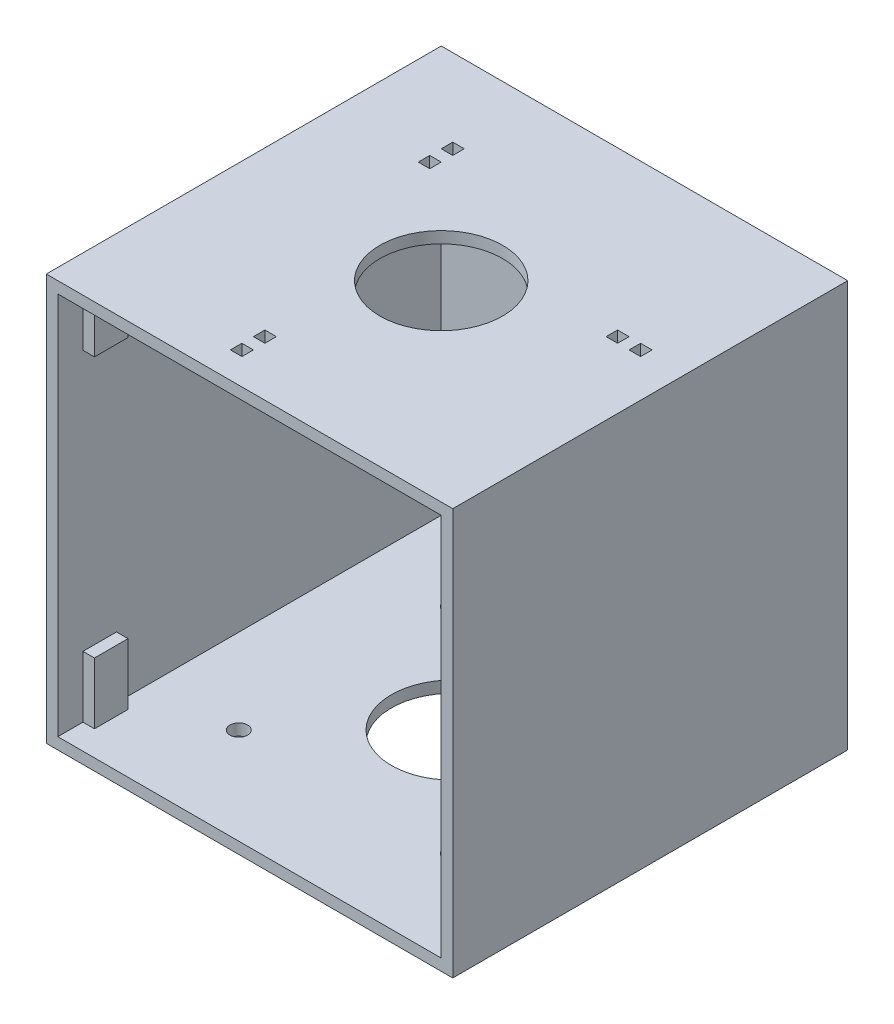
from build123d import *

# Parameters (mm, degrees)
SKETCH1_W                      = 53
SKETCH1_H                      = 53
BOSS_EXTRUDE1_DEPTH            = 51.5
SKETCH2_W                      = 50
SKETCH2_H                      = 50
CUT_EXTRUDE1_DEPTH             = 50
SKETCH3_W                      = 1.5
SKETCH3_H                      = 1.5
CUT_EXTRUDE2_DEPTH             = 90.20061659
SKETCH4_W                      = 1.5
SKETCH4_H                      = 1.5
CUT_EXTRUDE3_DEPTH             = 90.20061659
SKETCH5_W                      = 1.5
SKETCH5_H                      = 1.5
CUT_EXTRUDE4_DEPTH             = 90.20061659
SKETCH6_W                      = 1.5
SKETCH6_H                      = 1.5
CUT_EXTRUDE5_DEPTH             = 90.20061659
SKETCH7_W                      = 1.5
SKETCH7_H                      = 1.5
CUT_EXTRUDE6_DEPTH             = 90.20061659
CUT_EXTRUDE7_REACH             = 92.075
SKETCH8_W                      = 1.5
SKETCH8_H                      = 1.5
F_16_0_16_DIAMETER_HOLE1_D     = 16
F_16_0_16_DIAMETER_HOLE1_DEPTH = 1.5
F_2_3_2_3_DIAMETER_HOLE1_D     = 2.3
F_2_3_2_3_DIAMETER_HOLE1_DEPTH = 1.5
F_16_0_16_DIAMETER_HOLE2_D     = 16
F_16_0_16_DIAMETER_HOLE2_DEPTH = 1.5
RIB1_START                     = -2.185
RIB1_OUTLINE_W                 = 1.5
RIB1_OUTLINE_H                 = 8
RIB1_DEPTH                     = 4.37
RIB2_START                     = -2.185
RIB2_OUTLINE_W                 = 1.5
RIB2_OUTLINE_H                 = 8
RIB2_DEPTH                     = 4.37
RIB3_START                     = -2.185
RIB3_OUTLINE_W                 = 1.5
RIB3_OUTLINE_H                 = 8
RIB3_DEPTH                     = 4.37
RIB4_START                     = -2.185
RIB4_OUTLINE_W                 = 1.5
RIB4_OUTLINE_H                 = 8
RIB4_DEPTH                     = 4.37


# Read off the part's stored shape, not the designer's step: Rib1, Rib2, Rib3, Rib4
with BuildPart() as part:
    # Sketch1 → Boss-Extrude1 (new body)
    with BuildSketch(Plane.XY.offset(51.5)):
        with Locations((25, 25)):
            Rectangle(SKETCH1_W, SKETCH1_H)
    extrude(amount=-BOSS_EXTRUDE1_DEPTH)

    # Sketch2 → Cut-Extrude1 (cut)
    with BuildSketch(Plane.XY.offset(51.5)):
        with Locations((25, 25)):
            Rectangle(SKETCH2_W, SKETCH2_H)
    extrude(amount=-CUT_EXTRUDE1_DEPTH, mode=Mode.SUBTRACT)

    # Sketch3 → Cut-Extrude2 (cut, through all)
    with BuildSketch(Plane.XZ.offset(-50)):
        with Locations((45.818516526, 21.323619098)):
            Rectangle(SKETCH3_W, SKETCH3_H)
    extrude(amount=-CUT_EXTRUDE2_DEPTH, mode=Mode.SUBTRACT)

    # Sketch4 → Cut-Extrude3 (cut, through all)
    with BuildSketch(Plane.XZ.offset(-50)):
        with Locations((10.857864376, 13.857864376)):
            Rectangle(SKETCH4_W, SKETCH4_H)
    extrude(amount=-CUT_EXTRUDE3_DEPTH, mode=Mode.SUBTRACT)

    # Sketch5 → Cut-Extrude4 (cut, through all)
    with BuildSketch(Plane.XZ.offset(-50)):
        with Locations((19.823619098, 47.318516526)):
            Rectangle(SKETCH5_W, SKETCH5_H)
    extrude(amount=-CUT_EXTRUDE4_DEPTH, mode=Mode.SUBTRACT)

    # Sketch6 → Cut-Extrude5 (cut, through all)
    with BuildSketch(Plane.XZ.offset(-50)):
        with Locations((19.823619098, 44.318516526)):
            Rectangle(SKETCH6_W, SKETCH6_H)
    extrude(amount=-CUT_EXTRUDE5_DEPTH, mode=Mode.SUBTRACT)

    # Sketch7 → Cut-Extrude6 (cut, through all)
    with BuildSketch(Plane.XZ.offset(-50)):
        with Locations((10.857864376, 10.857864376)):
            Rectangle(SKETCH7_W, SKETCH7_H)
    extrude(amount=-CUT_EXTRUDE6_DEPTH, mode=Mode.SUBTRACT)

    # Sketch8 → Cut-Extrude7 (cut, up to next)
    with BuildSketch(Plane(origin=(0, 51.5, 0), x_dir=(-1, 0, 0), z_dir=(0, 1, 0)), mode=Mode.PRIVATE) as cut_extrude7_sk1:
        with Locations((-42.818516526, 21.323619098)):
            Rectangle(SKETCH8_W, SKETCH8_H)
    cut_extrude7_tool1 = extrude(cut_extrude7_sk1.sketch, amount=-CUT_EXTRUDE7_REACH, mode=Mode.PRIVATE) & part.part
    add(cut_extrude7_tool1.solids().sort_by_distance((42.818517, 51.5, 21.323619))[0], mode=Mode.SUBTRACT)

    # Ø16.0 (16) Diameter Hole1
    with Locations(Plane(origin=(0, -1.5, 0), x_dir=(-1, 0, 0), z_dir=(0, -1, 0))):
        with Locations((-25, -25)):
            Hole(F_16_0_16_DIAMETER_HOLE1_D / 2, depth=F_16_0_16_DIAMETER_HOLE1_DEPTH)

    # Ø2.3 (2.3) Diameter Hole1
    with Locations(Plane(origin=(0, 0, 0), x_dir=(1, 0, 0), z_dir=(0, 1, 0))):
        with Locations((38.95, -11.05), (11.05, -11.05), (11.05, -38.95), (38.95, -38.95)):
            Hole(F_2_3_2_3_DIAMETER_HOLE1_D / 2, depth=F_2_3_2_3_DIAMETER_HOLE1_DEPTH)

    # Ø16.0 (16) Diameter Hole2
    with Locations(Plane(origin=(0, 51.5, 0), x_dir=(1, 0, 0), z_dir=(0, 1, 0))):
        with Locations((25, -26.5)):
            Hole(F_16_0_16_DIAMETER_HOLE2_D / 2, depth=F_16_0_16_DIAMETER_HOLE2_DEPTH)

    # Rib1 outline → Rib1 (add)
    with BuildSketch(Plane(origin=(0, 0, 46.035), x_dir=(-1, 0, 0), z_dir=(0, 0, -1)).offset(RIB1_START)):
        with Locations((-49.25, 46)):
            Rectangle(RIB1_OUTLINE_W, RIB1_OUTLINE_H)
    extrude(amount=RIB1_DEPTH)

    # Rib2 outline → Rib2 (add)
    with BuildSketch(Plane(origin=(0, 0, 46.035), x_dir=(-1, 0, 0), z_dir=(0, 0, -1)).offset(RIB2_START)):
        with Locations((-0.75, 4)):
            Rectangle(RIB2_OUTLINE_W, RIB2_OUTLINE_H)
    extrude(amount=RIB2_DEPTH)

    # Rib3 outline → Rib3 (add)
    with BuildSketch(Plane.XY.offset(46.035).offset(RIB3_START)):
        with Locations((0.75, 46)):
            Rectangle(RIB3_OUTLINE_W, RIB3_OUTLINE_H)
    extrude(amount=RIB3_DEPTH)

    # Rib4 outline → Rib4 (add)
    with BuildSketch(Plane.XY.offset(46.035).offset(RIB4_START)):
        with Locations((49.25, 4)):
            Rectangle(RIB4_OUTLINE_W, RIB4_OUTLINE_H)
    extrude(amount=RIB4_DEPTH)


solid = part.part
